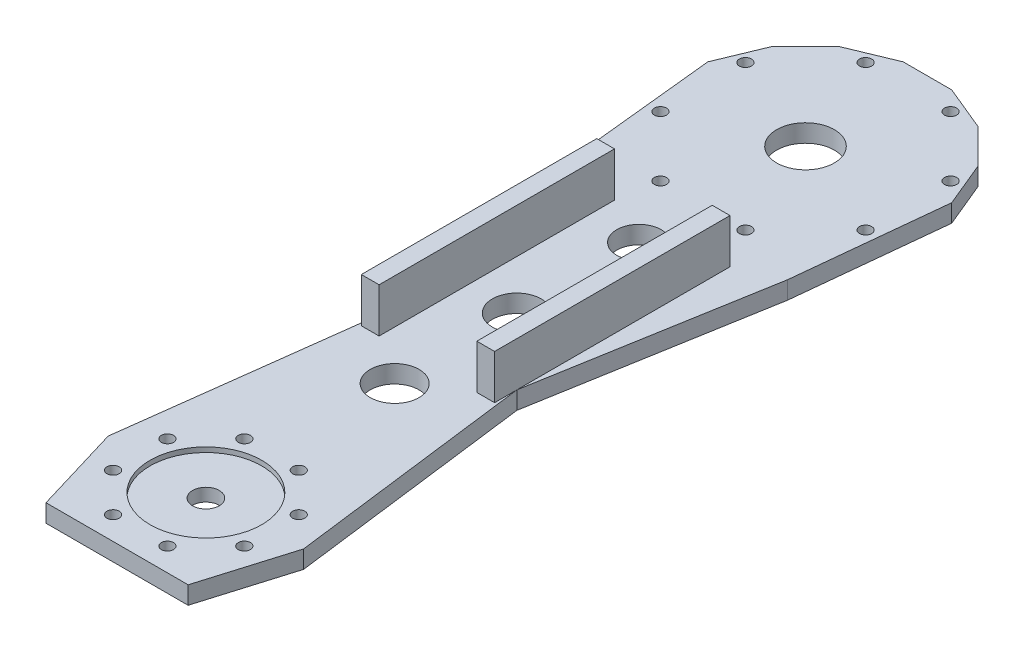
from build123d import *

# Parameters (mm, degrees)
SK_THIGH_PLATE_R         = 2.75
SK_THIGH_PLATE_R_2       = 6
SK_THIGH_PLATE_R_3       = 13
SK_THIGH_PLATE_R_4       = 11
SK_THIGH_PLATE_R_5       = 10
THIGH_PLATE_DEPTH        = 8
SK_PITCH_PILOT_RECESS_R  = 25.15
PITCH_PILOT_RECESS_DEPTH = 2.2
SK_FRONT_FLANGE_W        = 106
SK_FRONT_FLANGE_H        = 20
FRONT_FLANGE_DEPTH       = 8
SK_BACK_FLANGE_W         = 106
SK_BACK_FLANGE_H         = 20
BACK_FLANGE_DEPTH        = 8


with BuildPart() as part:
    # SK_Thigh_Plate → Thigh_Plate (new body)
    with BuildSketch(Plane(origin=(0, -44, 0), x_dir=(1, 0, 0), z_dir=(0, 1, 0))):
        Polygon((-32, -40), (32, -40), (44, 0), (30, 110), (48, 214), (54.923975703, 280.925058033), (46.562298289, 301.111933049), (31.111933049, 316.562298289), (10.925058033, 324.923975703), (-10.925058033, 324.923975703), (-31.111933049, 316.562298289), (-46.562298289, 301.111933049), (-54.923975703, 280.925058033), (-48, 214), (-30, 110), (-44, 0), align=None)
        with Locations((29.56414504, 12.245869836)):
            Circle(SK_THIGH_PLATE_R, mode=Mode.SUBTRACT)
        with Locations((12.245869836, 29.56414504)):
            Circle(SK_THIGH_PLATE_R, mode=Mode.SUBTRACT)
        with Locations((-12.245869836, 29.56414504)):
            Circle(SK_THIGH_PLATE_R, mode=Mode.SUBTRACT)
        with Locations((-29.56414504, 12.245869836)):
            Circle(SK_THIGH_PLATE_R, mode=Mode.SUBTRACT)
        with Locations((-29.56414504, -12.245869836)):
            Circle(SK_THIGH_PLATE_R, mode=Mode.SUBTRACT)
        with Locations((-12.245869836, -29.56414504)):
            Circle(SK_THIGH_PLATE_R, mode=Mode.SUBTRACT)
        with Locations((12.245869836, -29.56414504)):
            Circle(SK_THIGH_PLATE_R, mode=Mode.SUBTRACT)
        with Locations((29.56414504, -12.245869836)):
            Circle(SK_THIGH_PLATE_R, mode=Mode.SUBTRACT)
        with Locations((46.193976626, 289.134171618)):
            Circle(SK_THIGH_PLATE_R, mode=Mode.SUBTRACT)
        with Locations((19.134171618, 316.193976626)):
            Circle(SK_THIGH_PLATE_R, mode=Mode.SUBTRACT)
        with Locations((-19.134171618, 316.193976626)):
            Circle(SK_THIGH_PLATE_R, mode=Mode.SUBTRACT)
        with Locations((-46.193976626, 289.134171618)):
            Circle(SK_THIGH_PLATE_R, mode=Mode.SUBTRACT)
        with Locations((-46.193976626, 250.865828382)):
            Circle(SK_THIGH_PLATE_R, mode=Mode.SUBTRACT)
        with Locations((-19.134171618, 223.806023374)):
            Circle(SK_THIGH_PLATE_R, mode=Mode.SUBTRACT)
        with Locations((19.134171618, 223.806023374)):
            Circle(SK_THIGH_PLATE_R, mode=Mode.SUBTRACT)
        with Locations((46.193976626, 250.865828382)):
            Circle(SK_THIGH_PLATE_R, mode=Mode.SUBTRACT)
        Circle(SK_THIGH_PLATE_R_2, mode=Mode.SUBTRACT)
        with Locations((0, 270)):
            Circle(SK_THIGH_PLATE_R_3, mode=Mode.SUBTRACT)
        with Locations((0, 85)):
            Circle(SK_THIGH_PLATE_R_4, mode=Mode.SUBTRACT)
        with Locations((0, 140)):
            Circle(SK_THIGH_PLATE_R_4, mode=Mode.SUBTRACT)
        with Locations((0, 195)):
            Circle(SK_THIGH_PLATE_R_5, mode=Mode.SUBTRACT)
    extrude(amount=THIGH_PLATE_DEPTH)

    # SK_Pitch_Pilot_Recess → Pitch_Pilot_Recess (cut)
    with BuildSketch(Plane(origin=(0, -36, 0), x_dir=(1, 0, 0), z_dir=(0, 1, 0))):
        Circle(SK_PITCH_PILOT_RECESS_R)
    extrude(amount=-PITCH_PILOT_RECESS_DEPTH, mode=Mode.SUBTRACT)

    # SK_Front_Flange → Front_Flange (add)
    with BuildSketch(Plane(origin=(22, 0, 0), x_dir=(0, 0, -1), z_dir=(1, 0, 0))):
        with Locations((153, -26)):
            Rectangle(SK_FRONT_FLANGE_W, SK_FRONT_FLANGE_H)
    extrude(amount=FRONT_FLANGE_DEPTH)

    # SK_Back_Flange → Back_Flange (add)
    with BuildSketch(Plane(origin=(-30, 0, 0), x_dir=(0, 0, -1), z_dir=(1, 0, 0))):
        with Locations((153, -26)):
            Rectangle(SK_BACK_FLANGE_W, SK_BACK_FLANGE_H)
    extrude(amount=BACK_FLANGE_DEPTH)


solid = part.part
